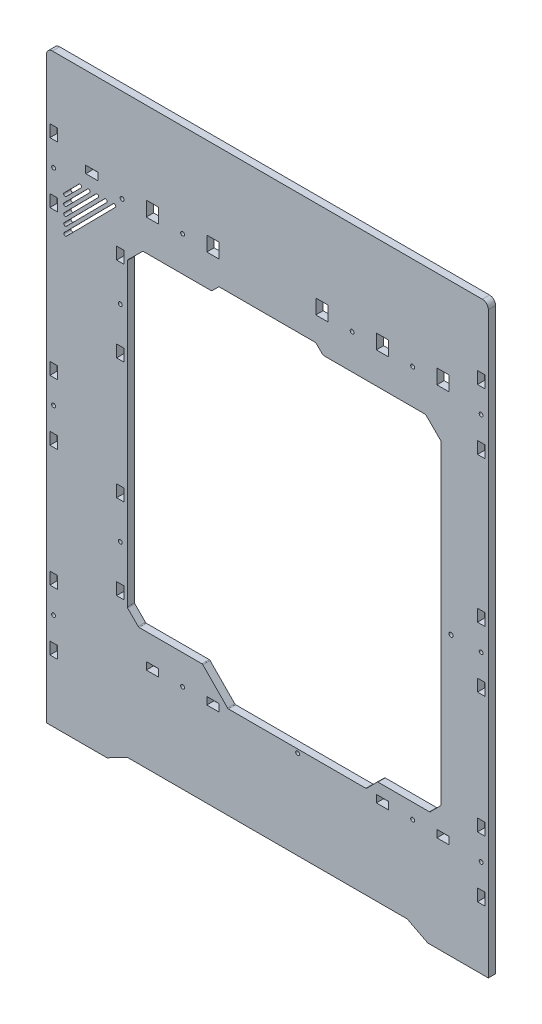
from build123d import *

# Parameters (mm, degrees)
SKETCH_1_W      = 6.1
SKETCH_1_H      = 10
SKETCH_1_R      = 1.6
SKETCH_1_W_2    = 10
SKETCH_1_H_2    = 6.1
SKETCH_1_R_2    = 1.7
SKETCH_1_H_3    = 12.1
EXTRUDE_1_DEPTH = 6


with BuildPart() as part:
    # Эскиз1 → Бобышка-Вытянуть1 (new body)
    with BuildSketch(Plane.XY):
        with BuildLine():
            Line((768.366546195, 520.00723929), (768.366546195, 485.00723929))
            Line((768.366546195, 485.00723929), (768.366546195, 477.00723929))
            Line((768.366546195, 477.00723929), (768.366546195, 42.00723929))
            Line((768.366546195, 42.00723929), (818.366546195, 42.00723929))
            Line((818.366546195, 42.00723929), (835.366546195, 50.73749629))
            Line((835.366546195, 50.73749629), (1066.366546195, 50.73749629))
            Line((1066.366546195, 50.73749629), (1083.366546195, 42.00723929))
            Line((1083.366546195, 42.00723929), (1133.366546195, 42.00723929))
            Line((1133.366546195, 42.00723929), (1133.366546195, 477.00723929))
            Line((1133.366546195, 477.00723929), (1133.366546195, 485.00723929))
            Line((1133.366546195, 485.00723929), (1133.366546195, 520.00723929))
            ThreePointArc((1133.366546195, 520.00723929), (1131.902080101, 523.542773196), (1128.366546195, 525.00723929))
            Line((1128.366546195, 525.00723929), (773.366546195, 525.00723929))
            ThreePointArc((773.366546195, 525.00723929), (769.831012289, 523.542773196), (768.366546195, 520.00723929))
        make_face()
        with Locations((774.316546195, 97.00723929)):
            Rectangle(SKETCH_1_W, SKETCH_1_H, mode=Mode.SUBTRACT)
        with Locations((774.316546195, 122.00723929)):
            Circle(SKETCH_1_R, mode=Mode.SUBTRACT)
        with Locations((774.316546195, 147.00723929)):
            Rectangle(SKETCH_1_W, SKETCH_1_H, mode=Mode.SUBTRACT)
        with Locations((855.866546195, 124.05491429)):
            Rectangle(SKETCH_1_W_2, SKETCH_1_H_2, mode=Mode.SUBTRACT)
        with Locations((880.866546195, 124.05491429)):
            Circle(SKETCH_1_R, mode=Mode.SUBTRACT)
        with Locations((905.866546195, 124.05491429)):
            Rectangle(SKETCH_1_W_2, SKETCH_1_H_2, mode=Mode.SUBTRACT)
        with Locations((829.416546195, 167.00723929)):
            Rectangle(SKETCH_1_W, SKETCH_1_H, mode=Mode.SUBTRACT)
        with Locations((829.416546195, 202.00723929)):
            Circle(SKETCH_1_R, mode=Mode.SUBTRACT)
        with Locations((774.316546195, 247.00723929)):
            Rectangle(SKETCH_1_W, SKETCH_1_H, mode=Mode.SUBTRACT)
        with Locations((774.316546195, 272.00723929)):
            Circle(SKETCH_1_R, mode=Mode.SUBTRACT)
        with Locations((829.416546195, 237.00723929)):
            Rectangle(SKETCH_1_W, SKETCH_1_H, mode=Mode.SUBTRACT)
        with Locations((975.866546195, 124.05491402)):
            Circle(SKETCH_1_R, mode=Mode.SUBTRACT)
        with Locations((1127.416546195, 97.00723929)):
            Rectangle(SKETCH_1_W, SKETCH_1_H, mode=Mode.SUBTRACT)
        with Locations((1045.866546195, 124.05491429)):
            Rectangle(SKETCH_1_W_2, SKETCH_1_H_2, mode=Mode.SUBTRACT)
        with Locations((1070.866546195, 124.05491429)):
            Circle(SKETCH_1_R, mode=Mode.SUBTRACT)
        with Locations((1095.866546195, 124.05491429)):
            Rectangle(SKETCH_1_W_2, SKETCH_1_H_2, mode=Mode.SUBTRACT)
        with Locations((1127.416546195, 122.00723929)):
            Circle(SKETCH_1_R, mode=Mode.SUBTRACT)
        with Locations((1127.416546195, 147.00723929)):
            Rectangle(SKETCH_1_W, SKETCH_1_H, mode=Mode.SUBTRACT)
        with BuildLine():
            Line((991.452332632, 424.583526443), (996.280759757, 419.755099318))
            ThreePointArc((996.280759757, 419.755099318), (996.929606455, 419.321553816), (997.694973319, 419.169312881))
            Line((997.694973319, 419.169312881), (1081.122260515, 419.169312881))
            ThreePointArc((1081.122260515, 419.169312881), (1081.50331118, 419.093867148), (1081.826864515, 418.878913881))
            Line((1081.826864515, 418.878913881), (1094.120077515, 406.672272881))
            ThreePointArc((1094.120077515, 406.672272881), (1094.338675602, 406.346986998), (1094.415473515, 405.962671881))
            Line((1094.415473515, 405.962671881), (1094.415473515, 146.420031881))
            ThreePointArc((1094.415473515, 146.420031881), (1094.340368819, 146.039810505), (1094.126336515, 145.716701881))
            Line((1094.126336515, 145.716701881), (1085.357153515, 136.853593881))
            ThreePointArc((1085.357153515, 136.853593881), (1085.031432616, 136.634066807), (1084.646289515, 136.556923881))
            Line((1084.646289515, 136.556923881), (1042.289008515, 136.556923881))
            ThreePointArc((1042.289008515, 136.556923881), (1041.903865529, 136.479781416), (1041.578144515, 136.260254881))
            Line((1041.578144515, 136.260254881), (1032.813350515, 127.401582881))
            ThreePointArc((1032.813350515, 127.401582881), (1032.487630078, 127.182055999), (1032.102487515, 127.104912881))
            Line((1032.102487515, 127.104912881), (918.728979515, 127.104912881))
            ThreePointArc((918.728979515, 127.104912881), (918.34230769, 127.182695398), (918.015788515, 127.403942881))
            Line((918.015788515, 127.403942881), (897.574498515, 148.201603881))
            ThreePointArc((897.574498515, 148.201603881), (897.24797934, 148.422851364), (896.861307515, 148.500633881))
            Line((896.861307515, 148.500633881), (844.938460515, 148.500633881))
            ThreePointArc((844.938460515, 148.500633881), (844.553318068, 148.577776538), (844.227597515, 148.797302881))
            Line((844.227597515, 148.797302881), (835.458413515, 157.660410881))
            ThreePointArc((835.458413515, 157.660410881), (835.244381748, 157.983519619), (835.169277515, 158.363740881))
            Line((835.169277515, 158.363740881), (835.169277515, 405.962671881))
            ThreePointArc((835.169277515, 405.962671881), (835.246075427, 406.346986998), (835.464673515, 406.672272881))
            Line((835.464673515, 406.672272881), (847.757886515, 418.878913881))
            ThreePointArc((847.757886515, 418.878913881), (848.08143985, 419.093867148), (848.462490515, 419.169312881))
            Line((848.462490515, 419.169312881), (904.03811907, 419.169312881))
            ThreePointArc((904.03811907, 419.169312881), (904.803485935, 419.321553816), (905.452332632, 419.755099318))
            Line((905.452332632, 419.755099318), (910.280759757, 424.583526443))
            ThreePointArc((910.280759757, 424.583526443), (910.929606455, 425.017071946), (911.694973319, 425.169312881))
            Line((911.694973319, 425.169312881), (990.03811907, 425.169312881))
            ThreePointArc((990.03811907, 425.169312881), (990.803485935, 425.017071946), (991.452332632, 424.583526443))
        make_face(mode=Mode.SUBTRACT)
        with Locations((1127.416546195, 247.00723929)):
            Rectangle(SKETCH_1_W, SKETCH_1_H, mode=Mode.SUBTRACT)
        with Locations((1102.521049053, 272.00723929)):
            Circle(SKETCH_1_R_2, mode=Mode.SUBTRACT)
        with Locations((1127.416546195, 272.00723929)):
            Circle(SKETCH_1_R, mode=Mode.SUBTRACT)
        with Locations((774.316546195, 297.00723929)):
            Rectangle(SKETCH_1_W, SKETCH_1_H, mode=Mode.SUBTRACT)
        with Locations((829.416546195, 337.00723929)):
            Rectangle(SKETCH_1_W, SKETCH_1_H, mode=Mode.SUBTRACT)
        with Locations((829.416546195, 372.00723929)):
            Circle(SKETCH_1_R, mode=Mode.SUBTRACT)
        with Locations((774.316546195, 417.00723929)):
            Rectangle(SKETCH_1_W, SKETCH_1_H, mode=Mode.SUBTRACT)
        with BuildLine():
            Line((797.021693195, 438.99752529), (784.715878195, 426.55498029))
            ThreePointArc((784.715878195, 426.55498029), (782.948138695, 426.54521379), (782.938372195, 428.31295329))
            Line((782.938372195, 428.31295329), (795.244186195, 440.75549829))
            ThreePointArc((795.244186195, 440.75549829), (797.011926195, 440.76526529), (797.021693195, 438.99752529))
        make_face(mode=Mode.SUBTRACT)
        with BuildLine():
            Line((818.234572195, 439.11472329), (784.833077195, 405.34210029))
            ThreePointArc((784.833077195, 405.34210029), (783.065337195, 405.33233329), (783.055570195, 407.10007329))
            Line((783.055570195, 407.10007329), (816.457066195, 440.87269729))
            ThreePointArc((816.457066195, 440.87269729), (818.224806195, 440.88246329), (818.234572195, 439.11472329))
        make_face(mode=Mode.SUBTRACT)
        with BuildLine():
            Line((811.163612195, 439.07565729), (784.794011195, 412.41306029))
            ThreePointArc((784.794011195, 412.41306029), (783.026271195, 412.40329329), (783.016504195, 414.17103329))
            Line((783.016504195, 414.17103329), (809.386106195, 440.83363129))
            ThreePointArc((809.386106195, 440.83363129), (811.153846195, 440.84339729), (811.163612195, 439.07565729))
        make_face(mode=Mode.SUBTRACT)
        with BuildLine():
            Line((804.092652195, 439.03659129), (784.754944195, 419.48402029))
            ThreePointArc((784.754944195, 419.48402029), (782.987204695, 419.47425379), (782.977438195, 421.24199329))
            Line((782.977438195, 421.24199329), (802.315146195, 440.79456529))
            ThreePointArc((802.315146195, 440.79456529), (804.082886195, 440.80433129), (804.092652195, 439.03659129))
        make_face(mode=Mode.SUBTRACT)
        with BuildLine():
            Line((825.305532195, 439.15378929), (784.872143195, 398.27114029))
            ThreePointArc((784.872143195, 398.27114029), (783.104403195, 398.26137329), (783.094636195, 400.02911329))
            Line((783.094636195, 400.02911329), (823.528026195, 440.91176329))
            ThreePointArc((823.528026195, 440.91176329), (825.295766195, 440.92152929), (825.305532195, 439.15378929))
        make_face(mode=Mode.SUBTRACT)
        with Locations((774.316546195, 442.00723929)):
            Circle(SKETCH_1_R, mode=Mode.SUBTRACT)
        with Locations((805.866546195, 454.05723929)):
            Rectangle(SKETCH_1_W_2, SKETCH_1_H_2, mode=Mode.SUBTRACT)
        with Locations((829.416546195, 407.00723929)):
            Rectangle(SKETCH_1_W, SKETCH_1_H, mode=Mode.SUBTRACT)
        with Locations((830.866546195, 448.05723929)):
            Circle(SKETCH_1_R, mode=Mode.SUBTRACT)
        with Locations((855.866546195, 451.05723929)):
            Rectangle(SKETCH_1_W_2, SKETCH_1_H_3, mode=Mode.SUBTRACT)
        with Locations((774.316546195, 467.00723929)):
            Rectangle(SKETCH_1_W, SKETCH_1_H, mode=Mode.SUBTRACT)
        with Locations((880.866546195, 448.05723929)):
            Circle(SKETCH_1_R, mode=Mode.SUBTRACT)
        with Locations((905.866546195, 451.05723929)):
            Rectangle(SKETCH_1_W_2, SKETCH_1_H_3, mode=Mode.SUBTRACT)
        with Locations((1127.416546195, 297.00723929)):
            Rectangle(SKETCH_1_W, SKETCH_1_H, mode=Mode.SUBTRACT)
        with Locations((995.866546195, 451.05723929)):
            Rectangle(SKETCH_1_W_2, SKETCH_1_H_3, mode=Mode.SUBTRACT)
        with Locations((1020.866546195, 448.05723929)):
            Circle(SKETCH_1_R, mode=Mode.SUBTRACT)
        with Locations((1045.866546195, 451.05723929)):
            Rectangle(SKETCH_1_W_2, SKETCH_1_H_3, mode=Mode.SUBTRACT)
        with Locations((1070.866546195, 448.05723929)):
            Circle(SKETCH_1_R, mode=Mode.SUBTRACT)
        with Locations((1127.416546195, 417.00723929)):
            Rectangle(SKETCH_1_W, SKETCH_1_H, mode=Mode.SUBTRACT)
        with Locations((1095.866546195, 451.05723929)):
            Rectangle(SKETCH_1_W_2, SKETCH_1_H_3, mode=Mode.SUBTRACT)
        with Locations((1127.416546195, 442.00723929)):
            Circle(SKETCH_1_R, mode=Mode.SUBTRACT)
        with Locations((1127.416546195, 467.00723929)):
            Rectangle(SKETCH_1_W, SKETCH_1_H, mode=Mode.SUBTRACT)
    extrude(amount=EXTRUDE_1_DEPTH)


solid = part.part
